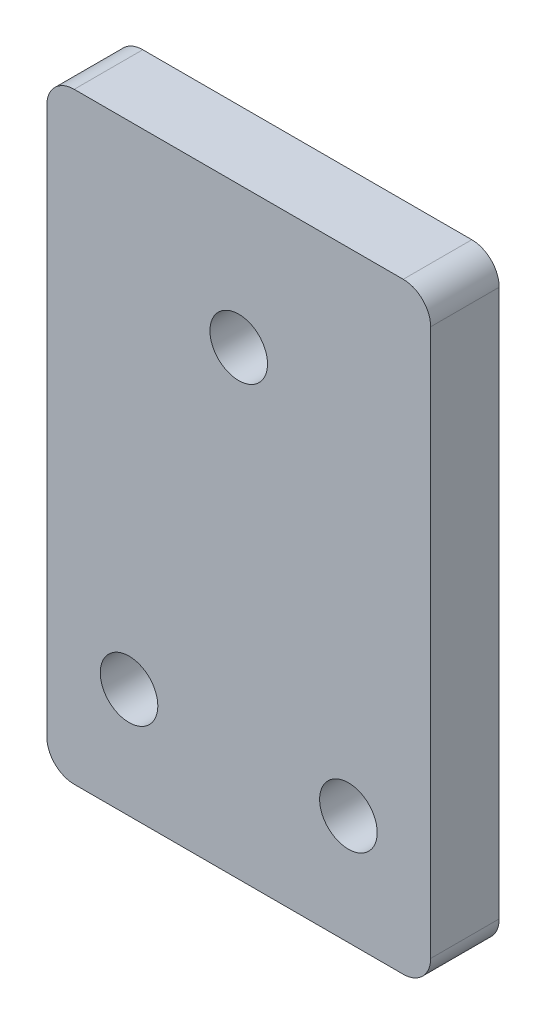
from build123d import *

# Parameters (mm, degrees)
BOSS_EXTRUDE1_OUTLINE_W = 28
BOSS_EXTRUDE1_OUTLINE_H = 43.9
BOSS_EXTRUDE1_OUTLINE_R = 2.1
BOSS_EXTRUDE1_DEPTH     = 5
FILLET1_R               = 2


# Read off the part's stored shape, not the designer's step: Boss-Extrude1
with BuildPart() as part:
    # Boss-Extrude1 outline → Boss-Extrude1 (new body)
    with BuildSketch(Plane.XY):
        with Locations((-62.5, 4.95)):
            Rectangle(BOSS_EXTRUDE1_OUTLINE_W, BOSS_EXTRUDE1_OUTLINE_H)
        with Locations((-70.5, -9)):
            Circle(BOSS_EXTRUDE1_OUTLINE_R, mode=Mode.SUBTRACT)
        with Locations((-54.5, -9)):
            Circle(BOSS_EXTRUDE1_OUTLINE_R, mode=Mode.SUBTRACT)
        with Locations((-62.5, 16.6)):
            Circle(BOSS_EXTRUDE1_OUTLINE_R, mode=Mode.SUBTRACT)
    extrude(amount=BOSS_EXTRUDE1_DEPTH)

    # Fillet1
    fillet1_edges = [part.edges().sort_by_distance(p)[0] for p in [
        (-76.5, 26.9, 2.5),
        (-48.5, 26.9, 2.5),
        (-48.5, -17, 2.5),
        (-76.5, -17, 2.5),
    ]]
    fillet(fillet1_edges, radius=FILLET1_R)


solid = part.part
